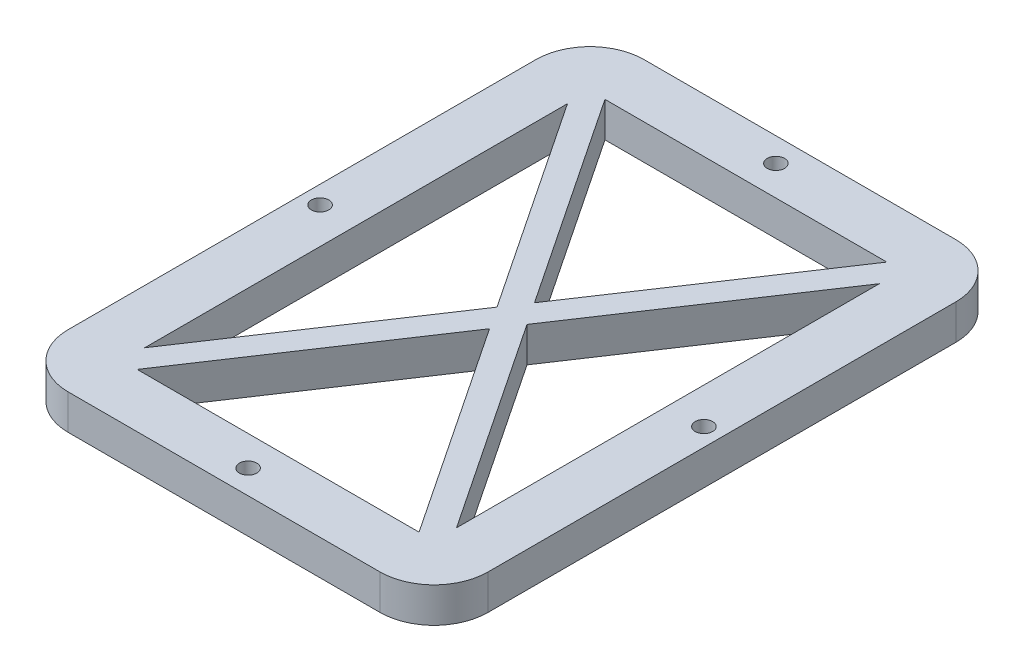
from build123d import *

# Parameters (mm, degrees)
SKETCH1_R           = 1.45
BOSS_EXTRUDE1_DEPTH = 5.85


with BuildPart() as part:
    # Sketch1 → Boss-Extrude1 (new body)
    with BuildSketch(Plane(origin=(0, 0, 0), x_dir=(1, 0, 0), z_dir=(0, 1, 0))):
        with BuildLine():
            ThreePointArc((-26, 48), (-32.363961031, 45.363961031), (-35, 39))
            Line((-35, 39), (-35, -39))
            ThreePointArc((-35, -39), (-32.363961031, -45.363961031), (-26, -48))
            Line((-26, -48), (26, -48))
            ThreePointArc((26, -48), (32.363961031, -45.363961031), (35, -39))
            Line((35, -39), (35, 39))
            ThreePointArc((35, 39), (32.363961031, 45.363961031), (26, 48))
            Line((26, 48), (-26, 48))
        make_face()
        with Locations((-32, 0)):
            Circle(SKETCH1_R, mode=Mode.SUBTRACT)
        with Locations((0, -44)):
            Circle(SKETCH1_R, mode=Mode.SUBTRACT)
        with Locations((32, 0)):
            Circle(SKETCH1_R, mode=Mode.SUBTRACT)
        Polygon((23.5, -39), (-23.5, -39), (0, -3.75), align=None, mode=Mode.SUBTRACT)
        Polygon((26, 35.25), (26, -35.25), (2.5, 0), align=None, mode=Mode.SUBTRACT)
        Polygon((-23.5, 39), (23.5, 39), (0, 3.75), align=None, mode=Mode.SUBTRACT)
        Polygon((-26, -35.25), (-26, 35.25), (-2.5, 0), align=None, mode=Mode.SUBTRACT)
        with Locations((0, 44)):
            Circle(SKETCH1_R, mode=Mode.SUBTRACT)
    extrude(amount=BOSS_EXTRUDE1_DEPTH)


solid = part.part
